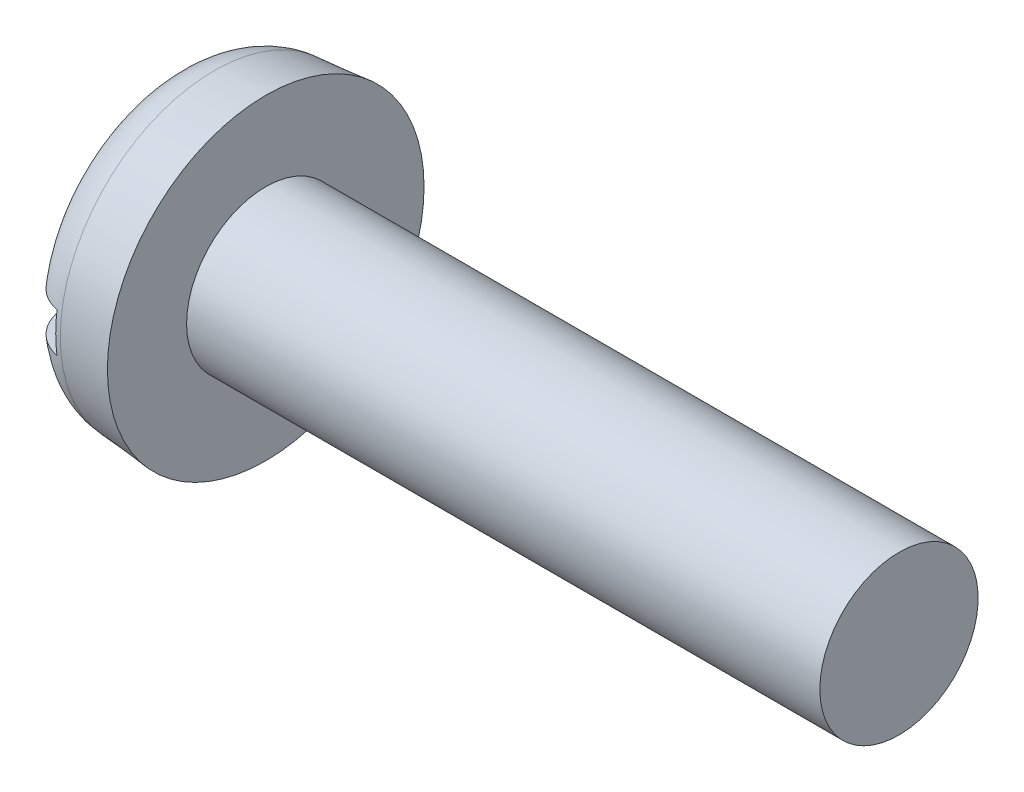
from build123d import *

# Parameters (mm, degrees)
FILLET2_R  = 3
SKETCH2_W  = 20
SKETCH2_H  = 2.5
SLOT_DEPTH = 2.4


with BuildPart() as part:
    # BodySke → Base-Revolve (revolve)
    with BuildSketch(Plane.XY):
        Polygon((6, 5), (6, 10), (0, 9.475068019), (0, 0), (46, 0), (46, 5), align=None)
    revolve(axis=Axis((-25.4, 0, 0), (1, 0, 0)))

    # Fillet2
    fillet2_edges = [part.edges().sort_by_distance(p)[0] for p in [
        (0, -9.475068019, 0),
    ]]
    fillet(fillet2_edges, radius=FILLET2_R)

    # Sketch2 → Slot (cut)
    with BuildSketch(Plane(origin=(0, 0, 0), x_dir=(0, 0, -1), z_dir=(1, 0, 0))):
        Rectangle(SKETCH2_W, SKETCH2_H)
    extrude(amount=SLOT_DEPTH, mode=Mode.SUBTRACT)


solid = part.part
